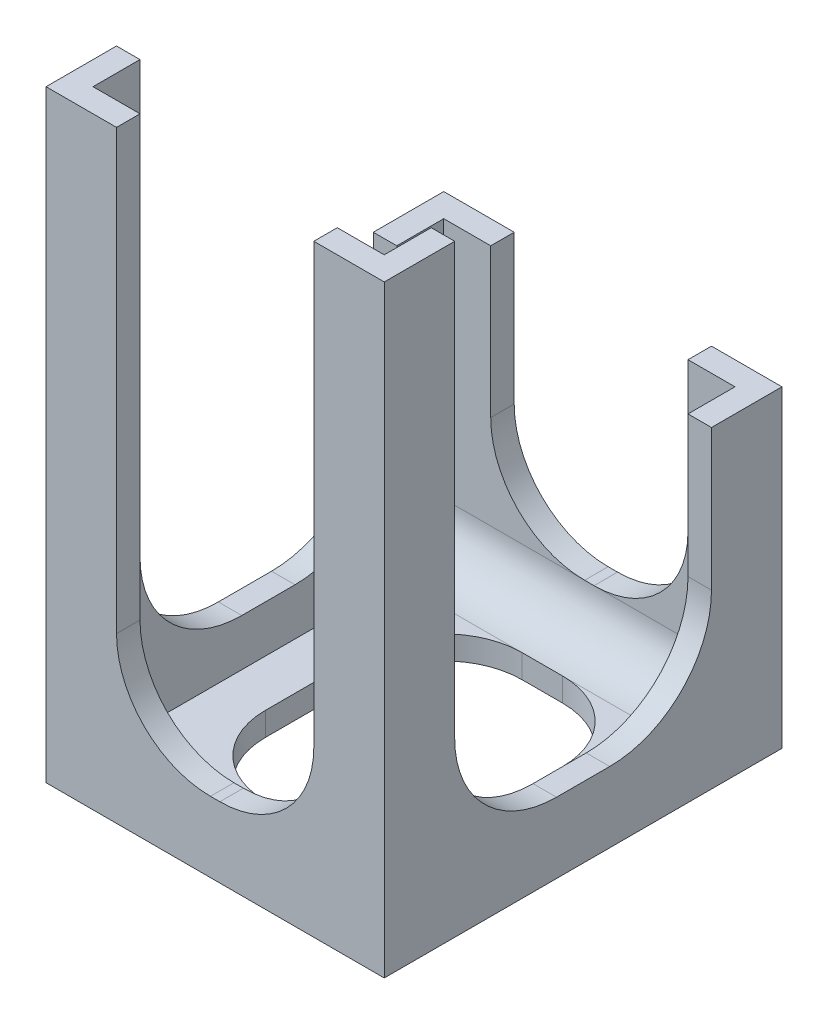
from build123d import *

# Parameters (mm, degrees)
SKETCH1_W           = 21.6
SKETCH1_H           = 25.4
BOSS_EXTRUDE1_DEPTH = 38.5
SKETCH2_W           = 18.6
SKETCH2_H           = 22.4
CUT_EXTRUDE1_DEPTH  = 37
CUT_EXTRUDE2_DEPTH  = 25.5
CUT_EXTRUDE3_DEPTH  = 25.5
CUT_EXTRUDE4_DEPTH  = 1.5
FILLET2_R           = 3
FILLET3_R           = 3
SKETCH7_W           = 21.6
SKETCH7_H           = 4.5
CUT_EXTRUDE5_DEPTH  = 18.5


with BuildPart() as part:
    # Sketch1 → Boss-Extrude1 (new body)
    with BuildSketch(Plane(origin=(0, 0, 0), x_dir=(1, 0, 0), z_dir=(0, 1, 0))):
        with Locations((-65.770128024, -32.78448737)):
            Rectangle(SKETCH1_W, SKETCH1_H)
    extrude(amount=BOSS_EXTRUDE1_DEPTH)

    # Sketch2 → Cut-Extrude1 (cut)
    with BuildSketch(Plane(origin=(0, 38.5, 0), x_dir=(1, 0, 0), z_dir=(0, 1, 0))):
        with Locations((-65.770128024, -32.78448737)):
            Rectangle(SKETCH2_W, SKETCH2_H)
    extrude(amount=-CUT_EXTRUDE1_DEPTH, mode=Mode.SUBTRACT)

    # Sketch5 → Cut-Extrude2 (cut)
    with BuildSketch(Plane.XY.offset(45.48448737)):
        with BuildLine():
            Line((-72.070128024, 38.5), (-59.470128024, 38.5))
            Line((-59.470128024, 38.5), (-59.470128024, 10.5))
            ThreePointArc((-59.470128024, 10.5), (-61.227487337, 6.257359313), (-65.470128024, 4.5))
            Line((-65.470128024, 4.5), (-66.070128024, 4.5))
            ThreePointArc((-66.070128024, 4.5), (-70.312768711, 6.257359313), (-72.070128024, 10.5))
            Line((-72.070128024, 10.5), (-72.070128024, 38.5))
        make_face()
    extrude(amount=-CUT_EXTRUDE2_DEPTH, mode=Mode.SUBTRACT)

    # Sketch3 → Cut-Extrude3 (cut)
    with BuildSketch(Plane(origin=(-54.970128024, 0, 0), x_dir=(0, 0, -1), z_dir=(1, 0, 0))):
        with BuildLine():
            Line((-40.98448737, 38.5), (-24.58448737, 38.5))
            Line((-24.58448737, 38.5), (-24.58448737, 11))
            ThreePointArc((-24.58448737, 11), (-26.488293292, 6.403805922), (-31.08448737, 4.5))
            Line((-31.08448737, 4.5), (-34.48448737, 4.5))
            ThreePointArc((-34.48448737, 4.5), (-39.080681448, 6.403805922), (-40.98448737, 11))
            Line((-40.98448737, 11), (-40.98448737, 38.5))
        make_face()
    extrude(amount=-CUT_EXTRUDE3_DEPTH, mode=Mode.SUBTRACT)

    # Sketch6 → Cut-Extrude4 (cut)
    with BuildSketch(Plane(origin=(0, 1.5, 0), x_dir=(1, 0, 0), z_dir=(0, 1, 0))):
        with BuildLine():
            Line((-67.070128024, -40.98448737), (-64.470128024, -40.98448737))
            ThreePointArc((-64.470128024, -40.98448737), (-60.934594118, -39.520021276), (-59.470128024, -35.98448737))
            Line((-59.470128024, -35.98448737), (-59.470128024, -29.58448737))
            ThreePointArc((-59.470128024, -29.58448737), (-60.934594118, -26.048953464), (-64.470128024, -24.58448737))
            Line((-64.470128024, -24.58448737), (-67.070128024, -24.58448737))
            ThreePointArc((-67.070128024, -24.58448737), (-70.60566193, -26.048953464), (-72.070128024, -29.58448737))
            Line((-72.070128024, -29.58448737), (-72.070128024, -35.98448737))
            ThreePointArc((-72.070128024, -35.98448737), (-70.60566193, -39.520021276), (-67.070128024, -40.98448737))
        make_face()
    extrude(amount=-CUT_EXTRUDE4_DEPTH, mode=Mode.SUBTRACT)

    # Fillet2
    fillet2_edges = [part.edges().sort_by_distance(p)[0] for p in [
        (-65.770128024, 1.5, 43.98448737),
    ]]
    fillet(fillet2_edges, radius=FILLET2_R - 0.0001)  # a hair under: the kernel refuses the full size

    # Fillet3
    fillet3_edges = [part.edges().sort_by_distance(p)[0] for p in [
        (-65.770128024, 1.5, 21.58448737),
    ]]
    fillet(fillet3_edges, radius=FILLET3_R - 0.0001)  # a hair under: the kernel refuses the full size

    # Sketch7 → Cut-Extrude5 (cut)
    with BuildSketch(Plane(origin=(0, 38.5, 0), x_dir=(1, 0, 0), z_dir=(0, 1, 0))):
        with Locations((-65.770128024, -22.33448737)):
            Rectangle(SKETCH7_W, SKETCH7_H)
    extrude(amount=-CUT_EXTRUDE5_DEPTH, mode=Mode.SUBTRACT)


solid = part.part
